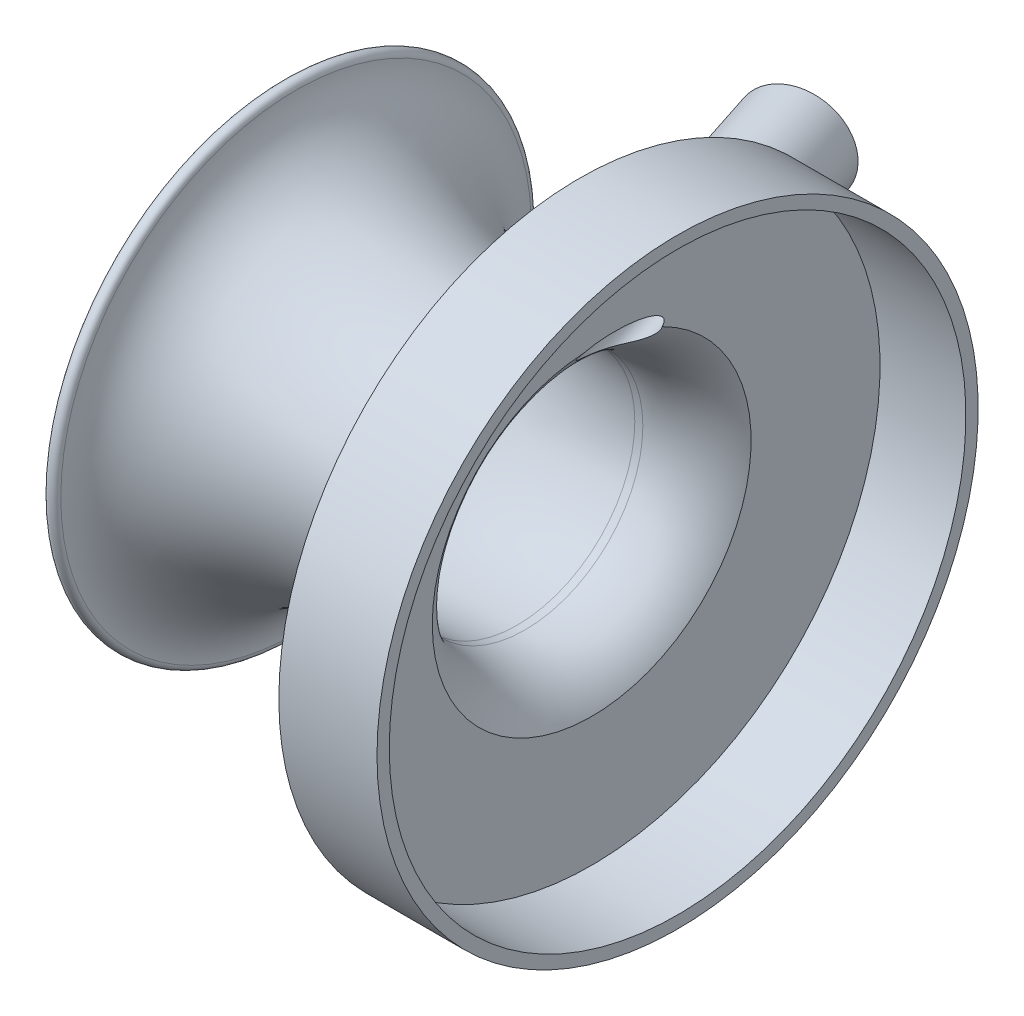
from build123d import *

# Parameters (mm, degrees)
BOSS_EXTRUDE1_REACH      = 140.716
SKETCH2_R                = 5.55625
SKETCH2_R_2              = 3.175
CUT_EXTRUDE1_DEPTH       = 139.716302058
CUT_EXTRUDE1_DEPTH_BACK  = 40.64
SKETCH2_3_R              = 3.175
BOSS_EXTRUDE3_DEPTH      = 25.4
BOSS_EXTRUDE3_DEPTH_BACK = 1.016
SKETCH2_4_R              = 10.16
SKETCH2_4_R_2            = 5.55625


with BuildPart() as part:
    # Sketch1 → Revolve1 (revolve)
    with BuildSketch(Plane.XY):
        with BuildLine():
            Line((-17.78, 33.403326565), (-17.78, 60.093265565))
            Line((-17.78, 60.093265565), (0, 60.093265565))
            Line((0, 60.093265565), (0, 62.633265565))
            Line((0, 62.633265565), (-20.32, 62.633265565))
            Line((-20.32, 62.633265565), (-20.32, 34.099917601))
            ThreePointArc((-20.32, 34.099917601), (-25.180755406, 29.340296974), (-31.679989745, 27.330101799))
            Line((-31.679989745, 27.330101799), (-33.2365138, 27.301858752))
            add(Edge.make_bspline(
                [(-78.987624158, 49.101480512), (-78.987360194, 48.465111349), (-78.864304013, 47.206846617), (-78.115388687, 44.647319746), (-76.172826927, 41.382782544), (-72.124745626, 37.542839726), (-66.466655311, 34.059492548), (-59.433052835, 31.146010824), (-51.317519817, 28.959245462), (-42.474533701, 27.605945243), (-36.295988449, 27.30132344), (-33.2365138, 27.301858752)],
                knots=[3.141592654, 3.141592654, 3.141592654, 3.141592654, 3.239737699, 3.337882745, 3.534172837, 3.730462929, 3.92675302, 4.123043112, 4.319333204, 4.515623295, 4.711913387, 4.711913387, 4.711913387, 4.711913387], degree=3))
            ThreePointArc((-78.987624158, 49.101480512), (-80.258150841, 50.37095361), (-81.52762394, 49.100426927))
            add(Edge.make_bspline(
                [(-81.52762394, 49.100426927), (-81.51752006, 24.741829023), (-33.213096121, 24.761865565)],
                knots=[0, 0, 0, 1.570796327, 1.570796327, 1.570796327], degree=2, weights=[1, 0.707106781, 1]))
            Line((-33.213096121, 24.761865565), (-31.579850242, 24.791500725))
            ThreePointArc((-31.579850242, 24.791500725), (-23.583053734, 27.339753754), (-17.78, 33.403326565))
        make_face()
    revolve(axis=Axis((-34.322208184, 0.403265565, 0), (1, 0, 0)))


with BuildPart() as body_2:

    # Sketch2 → Boss-Extrude1 (new, up to next)
    with BuildSketch(Plane(origin=(-13.343353817, 0, -41.066620374), x_dir=(0, -1, 0), z_dir=(-0.3090169943749514, 0, -0.9510565162951523)), mode=Mode.PRIVATE) as boss_extrude1_sk1:
        with Locations((-30.889259617, 15.45046582)):
            Circle(SKETCH2_R)
        with Locations((-30.889259617, 15.45046582)):
            Circle(SKETCH2_R_2, mode=Mode.SUBTRACT)
    boss_extrude1_tool1 = extrude(boss_extrude1_sk1.sketch, amount=-BOSS_EXTRUDE1_REACH, mode=Mode.PRIVATE) - part.part
    add(boss_extrude1_tool1.solids().sort_by_distance((-28.03762, 36.288355, -36.292164))[0])


with BuildPart() as part_1:
    add(part.part)

    # Sketch2<3> → Cut-Extrude1 (cut, two sides: drawn at the far end of the back side and taken through both)
    with BuildSketch(Plane(origin=(-13.343353817, 0, -41.066620374), x_dir=(0, -1, 0), z_dir=(-0.3090169943749514, 0, -0.9510565162951523)).offset(-CUT_EXTRUDE1_DEPTH_BACK)):
        with Locations((-30.889259617, 15.45046582)):
            Circle(SKETCH2_3_R)
    extrude(amount=CUT_EXTRUDE1_DEPTH + CUT_EXTRUDE1_DEPTH_BACK, mode=Mode.SUBTRACT)

    add(body_2.part)  # Boss-Extrude3 merges body 2
    # Sketch2<4> → Boss-Extrude3 (add, two sides: drawn at the far end of the back side and taken through both)
    with BuildSketch(Plane(origin=(-13.343353817, 0, -41.066620374), x_dir=(0, -1, 0), z_dir=(-0.3090169943749514, 0, -0.9510565162951523)).offset(-BOSS_EXTRUDE3_DEPTH_BACK)):
        with Locations((-30.889259617, 15.45046582)):
            Circle(SKETCH2_4_R)
        with Locations((-30.889259617, 15.45046582)):
            Circle(SKETCH2_4_R_2, mode=Mode.SUBTRACT)
    extrude(amount=BOSS_EXTRUDE3_DEPTH + BOSS_EXTRUDE3_DEPTH_BACK)


solid = part_1.part
